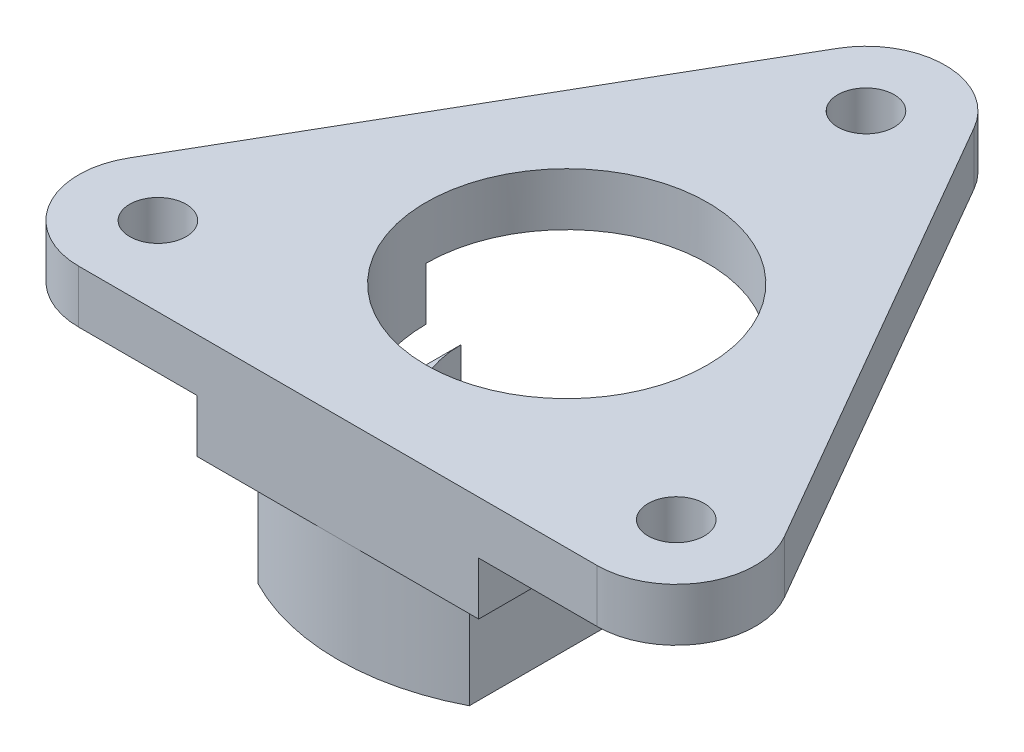
from build123d import *

# Parameters (mm, degrees)
EXTRUDE_1_DEPTH   = 6
EXTRUDE_2_DEPTH   = 3
SKETCH_4_R        = 8
EXTRUDE_3_DEPTH   = 3
OTHER_START       = -10.160108376
OTHER_1_OUTLINE_R = 1.6
OTHER_1_DEPTH     = 3


# Read off the part's stored shape, not the designer's step: 高级异型孔1
with BuildPart() as part:
    # 草图1 → 凸台-拉伸1 (new body)
    with BuildSketch(Plane(origin=(0, -13.160108376, 0), x_dir=(1, 0, 0), z_dir=(0, 1, 0))):
        with BuildLine():
            Line((-6, 0), (-6, -11.532562595))
            ThreePointArc((-6, -11.532562595), (0, -13), (6, -11.532562595))
            Line((6, -11.532562595), (6, 0))
            ThreePointArc((6, 0), (0, -6), (-6, 0))
        make_face()
    extrude(amount=-EXTRUDE_1_DEPTH)

    # 草图2 → 凸台-拉伸2 (add)
    with BuildSketch(Plane(origin=(0, -13.160108376, 0), x_dir=(1, 0, 0), z_dir=(0, 1, 0))):
        with BuildLine():
            Line((-8, 0), (-8, -13))
            Line((-8, -13), (8, -13))
            Line((8, -13), (8, 0))
            ThreePointArc((8, 0), (0, -8), (-8, 0))
        make_face()
    extrude(amount=EXTRUDE_2_DEPTH)

    # 草图4 → 凸台-拉伸3 (add)
    with BuildSketch(Plane(origin=(0, -10.160108376, -27), x_dir=(1, 0, 0), z_dir=(0, 1, 0))):
        with BuildLine():
            Line((-3.897114317, -7.75), (-18.619546181, -33.25))
            ThreePointArc((-18.619546181, -33.25), (-18.619546181, -37.75), (-14.722431864, -40))
            Line((-14.722431864, -40), (14.722431864, -40))
            ThreePointArc((14.722431864, -40), (18.619546181, -37.75), (18.619546181, -33.25))
            Line((18.619546181, -33.25), (3.897114317, -7.75))
            ThreePointArc((3.897114317, -7.75), (0, -5.5), (-3.897114317, -7.75))
        make_face()
        with Locations((0, -27)):
            Circle(SKETCH_4_R, mode=Mode.SUBTRACT)
    extrude(amount=EXTRUDE_3_DEPTH)

    # 高级异型孔1 outline → 高级异型孔1 (cut)
    with BuildSketch(Plane(origin=(0, 0, 0), x_dir=(1, 0, 0), z_dir=(0, 1, 0)).offset(OTHER_START)):
        with Locations((-14.722431864, -8.5)):
            Circle(OTHER_1_OUTLINE_R)
        with Locations((14.722431864, -8.5)):
            Circle(OTHER_1_OUTLINE_R)
        with Locations((0, 17)):
            Circle(OTHER_1_OUTLINE_R)
    extrude(amount=OTHER_1_DEPTH, mode=Mode.SUBTRACT)


solid = part.part
